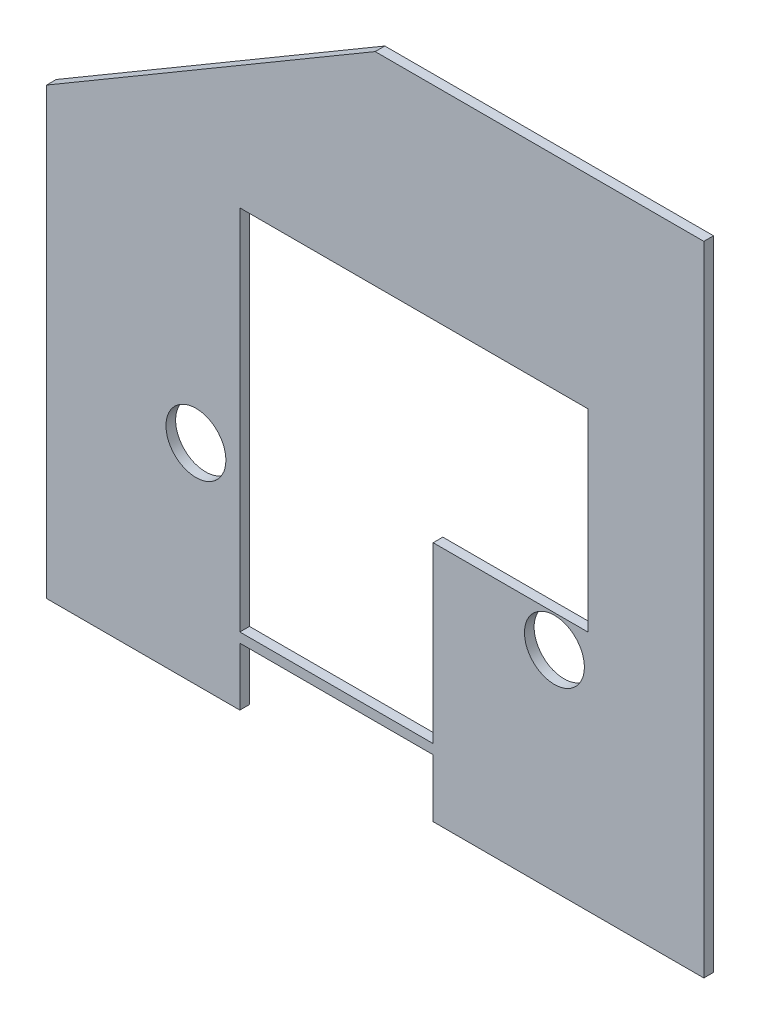
from build123d import *

# Parameters (mm, degrees)
FRAME_EXTERIOR_MASTER_OUTLINE_R = 19.685
FRAME_EXTERIOR_MASTER_DEPTH     = 6.35
CUT_EXTRUDE1_DEPTH              = 611.690430988


# Read off the part's stored shape, not the designer's step: Frame Exterior Master
with BuildPart() as part:
    # Frame Exterior Master outline → Frame Exterior Master (new body)
    with BuildSketch(Plane.XY):
        Polygon((431.8, 12.7), (431.8, 431.8), (215.9, 431.8), (0, 304.8), (0, 12.7), (127, 12.7), (127, 50.8), (254, 50.8), (254, 12.7), align=None)
        with Locations((98.15, 150.3)):
            Circle(FRAME_EXTERIOR_MASTER_OUTLINE_R, mode=Mode.SUBTRACT)
        with Locations((333.65, 150.3)):
            Circle(FRAME_EXTERIOR_MASTER_OUTLINE_R, mode=Mode.SUBTRACT)
    extrude(amount=FRAME_EXTERIOR_MASTER_DEPTH)

    # Sketch1 → Cut-Extrude1 (cut, through all)
    with BuildSketch(Plane.XY.offset(6.35)):
        Polygon((127, 298.45), (127, 57.15), (254, 57.15), (254, 171.45), (355.6, 171.45), (355.6, 298.45), align=None)
    extrude(amount=-CUT_EXTRUDE1_DEPTH, mode=Mode.SUBTRACT)


solid = part.part
